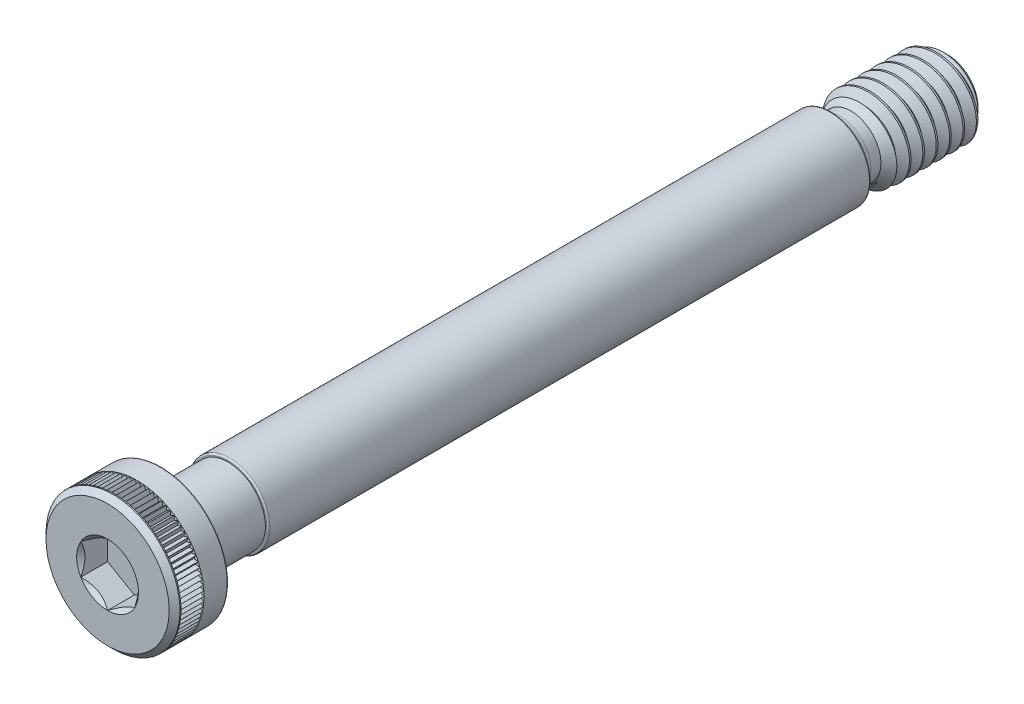
from build123d import *

# Parameters (mm, degrees)
CUT_EXTRUDE2_DEPTH = 1
SKETCH9_R          = 1.154700538
CUT_EXTRUDE4_DEPTH = 1
CUT_EXTRUDE4_DRAFT = -45
CUT_SWEEP1_PITCH   = 0.5
CUT_EXTRUDE5_DEPTH = 0.86
CIRPATTERN1_COUNT  = 90


with BuildPart() as part:
    # Sketch12 → Revolve1 (revolve)
    with BuildSketch(Plane(origin=(0, 0, 0), x_dir=(0, 0, -1), z_dir=(1, 0, 0)), mode=Mode.PRIVATE) as revolve1_sk:
        with BuildLine():
            Line((-15.6875, 0), (-15.6875, 2.3))
            Line((-15.6875, 2.3), (-15.4875, 2.5))
            Line((-15.4875, 2.5), (-13.7275, 2.5))
            ThreePointArc((-13.7275, 2.5), (-13.699215729, 2.488284271), (-13.6875, 2.46))
            Line((-13.6875, 2.46), (-13.6875, 1.395))
            Line((-13.6875, 1.395), (-11.1875, 1.395))
            Line((-11.1875, 1.395), (-11.1875, 1.44))
            ThreePointArc((-11.1875, 1.44), (-11.169926407, 1.482426407), (-11.1275, 1.5))
            Line((-11.1275, 1.5), (11.256657802, 1.5))
            ThreePointArc((11.256657802, 1.5), (11.296049731, 1.485257882), (11.316084312, 1.448275862))
            ThreePointArc((11.316084312, 1.448275862), (11.441300438, 1.217138239), (11.6875, 1.125))
            Line((11.6875, 1.125), (12.0625, 1.125))
            Line((12.0625, 1.125), (12.4375, 1.5))
            Line((12.4375, 1.5), (15.3125, 1.5))
            Line((15.3125, 1.5), (15.6875, 1.125))
            Line((15.6875, 1.125), (15.6875, 0))
            Line((15.6875, 0), (-15.6875, 0))
        make_face()
    revolve(revolve1_sk.sketch.rotate(Axis((0, 0, -15.6875), (0, 0, 1)), 90), axis=Axis((0, 0, -15.6875), (0, 0, 1)))

    # Sketch8 → Cut-Extrude2 (cut)
    with BuildSketch(Plane.XY.offset(15.6875)):
        Polygon((0, -1.154700538), (1, -0.577350269), (1, 0.577350269), (0, 1.154700538), (-1, 0.577350269), (-1, -0.577350269), align=None)
    extrude(amount=-CUT_EXTRUDE2_DEPTH, mode=Mode.SUBTRACT)


with BuildPart() as cut_extrude4_tool:
    # Sketch9 → Cut-Extrude4 (with draft: the straight prism first)
    with BuildSketch(Plane.XY.offset(15.6875)):
        Circle(SKETCH9_R)
    extrude(amount=-CUT_EXTRUDE4_DEPTH)
    # Cut-Extrude4: the draft: its side faces are tilted about the plane it starts from
    cut_extrude4_sides = [cut_extrude4_tool.faces().sort_by_distance(p)[0] for p in [
        (-1.154700538, 0, 15.1875),
    ]]
    draft(cut_extrude4_sides, Plane.XY.offset(15.6875), CUT_EXTRUDE4_DRAFT)


with BuildPart() as part_1:
    add(part.part)

    # Cut-Extrude4: cut by cut_extrude4_tool
    add(cut_extrude4_tool.part, mode=Mode.SUBTRACT)


with BuildPart() as body_2:
    # Split1: the piece on the far side of the plane
    add(part_1.part)
    split(bisect_by=Plane(origin=(0, 0, -12.0625), x_dir=(0, -1, 0), z_dir=(0, 0, -1)), keep=Keep.BOTTOM)


with BuildPart() as part_2:
    add(part_1.part)

    # Split1
    split(bisect_by=Plane(origin=(0, 0, -12.0625), x_dir=(0, -1, 0), z_dir=(0, 0, -1)), keep=Keep.TOP)

    # Cut-Sweep1: the profile of Sketch13 screwed along a right-hand helix of 8 turns, 6 arcs to a turn; built about Z, then put on its axis
    cut_sweep1_z = Axis((0, 0, 0), (0, 0, 1))
    cut_sweep1_corners = [(1.527063294, 0, 0.015625), (1.527063294, 0, -0.453125), (1.175240474, 0, -0.25), (1.175240474, 0, -0.1875)]
    with BuildLine(mode=Mode.PRIVATE) as cut_sweep1_profile:
        Line(cut_sweep1_corners[0], cut_sweep1_corners[1])
        Line(cut_sweep1_corners[1], cut_sweep1_corners[2])
        Line(cut_sweep1_corners[2], cut_sweep1_corners[3])
        Line(cut_sweep1_corners[3], cut_sweep1_corners[0])
    cut_sweep1_cap = Face(cut_sweep1_profile.wire())
    cut_sweep1_turn_angles = [0, 30, 60, 90, 120, 150, 180, 210, 240, 270, 300, 330, 360]
    cut_sweep1_turn_weights = [1, 0.8660254037844387, 1, 0.8660254037844387, 1, 0.8660254037844387, 1, 0.8660254037844387, 1, 0.8660254037844387, 1, 0.8660254037844387, 1]
    cut_sweep1_turn_rails = [Edge.make_bspline([Vector(p[0], p[1], 0).rotate(cut_sweep1_z, cut_sweep1_turn_angles[k]) / cut_sweep1_turn_weights[k] + Vector(0, 0, p[2] + CUT_SWEEP1_PITCH * cut_sweep1_turn_angles[k] / 360) for k in range(13)], [0, 0, 0, 1, 1, 2, 2, 3, 3, 4, 4, 5, 5, 6, 6, 6], 2, cut_sweep1_turn_weights) for p in cut_sweep1_corners]
    cut_sweep1_turn_sides = [Face.make_surface_from_curves(cut_sweep1_turn_rails[p[0]], cut_sweep1_turn_rails[p[1]]) for p in [(0, 1), (1, 2), (2, 3), (3, 0)]]
    cut_sweep1 = Plane(origin=(0, 0, -15.6875), x_dir=(0, 1, 0), z_dir=(0, 0, 1)) * Solid(Shell([*[p.moved(Location((0, 0, CUT_SWEEP1_PITCH * i))) for i in range(8) for p in cut_sweep1_turn_sides], cut_sweep1_cap, cut_sweep1_cap.rotate(cut_sweep1_z, 2880).moved(Location((0, 0, CUT_SWEEP1_PITCH * 2880 / 360)))]))
    add(cut_sweep1, mode=Mode.SUBTRACT)


with BuildPart() as body_2_1:
    add(body_2.part)

    # Combine1: union part
    add(part_2.part)

    # Sketch11 → Cut-Extrude5 (cut)
    with BuildSketch(Plane.XY.offset(15.4475)):
        Polygon((0.087301924, 2.5), (0, 2.348788633), (-0.087301924, 2.5), align=None)
    cut_extrude5 = extrude(amount=-CUT_EXTRUDE5_DEPTH, mode=Mode.SUBTRACT)

    # CirPattern1: Cut-Extrude5 ×90 about axis
    cirpattern1_axis = Axis((0, 0, 0), (0, 0, 1))
    for i in range(1, CIRPATTERN1_COUNT):
        add(cut_extrude5.rotate(cirpattern1_axis, i * 360 / CIRPATTERN1_COUNT), mode=Mode.SUBTRACT)


solid = body_2_1.part
